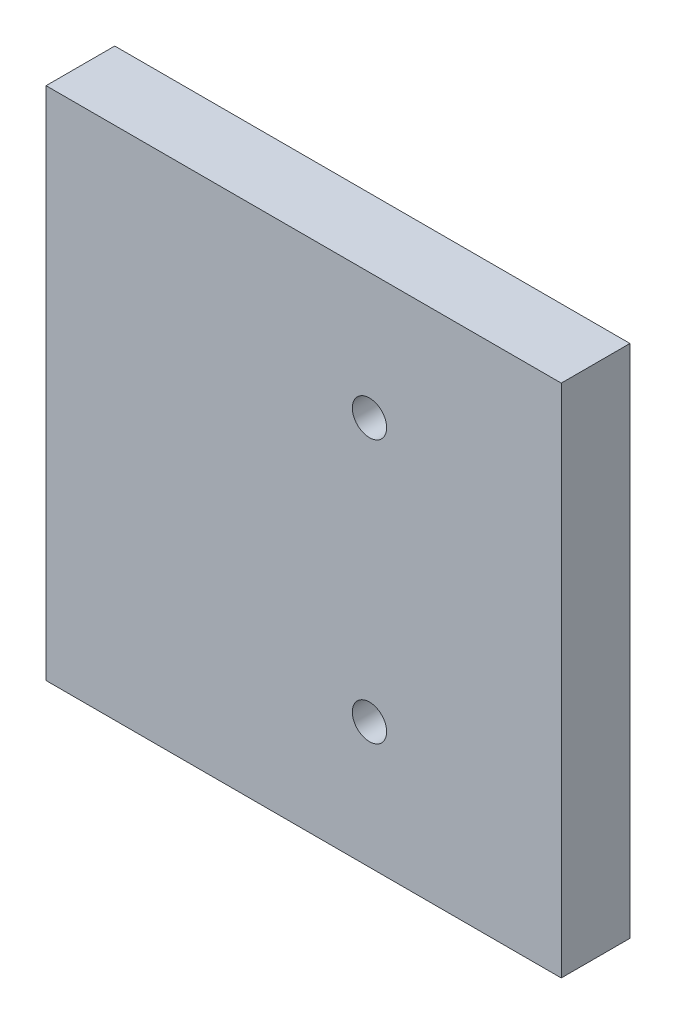
from build123d import *

# Parameters (mm, degrees)
SKETCH1_W               = 45
SKETCH1_H               = 45
BOSS_EXTRUDE1_DEPTH     = 6
CUT_EXTRUDE1_DEPTH      = 79.805008682
CUT_EXTRUDE1_DEPTH_BACK = 7.5
SKETCH2_R               = 1.5


with BuildPart() as part:
    # Sketch1 → Boss-Extrude1 (new body)
    with BuildSketch(Plane.XY):
        with Locations((22.5, 22.5)):
            Rectangle(SKETCH1_W, SKETCH1_H)
    extrude(amount=BOSS_EXTRUDE1_DEPTH)

    # Sketch2 → Cut-Extrude1 (cut, two sides: drawn at the far end of the back side and taken through both)
    with BuildSketch(Plane(origin=(62.434592899, 22.5, -36.495893953), x_dir=(0, 1, 0), z_dir=(0, 0, 1)).offset(-CUT_EXTRUDE1_DEPTH_BACK)):
        with Locations((11.5, 34.184592899)):
            Circle(SKETCH2_R)
        with Locations((-11.5, 34.184592899)):
            Circle(SKETCH2_R)
    extrude(amount=CUT_EXTRUDE1_DEPTH + CUT_EXTRUDE1_DEPTH_BACK, mode=Mode.SUBTRACT)


solid = part.part
